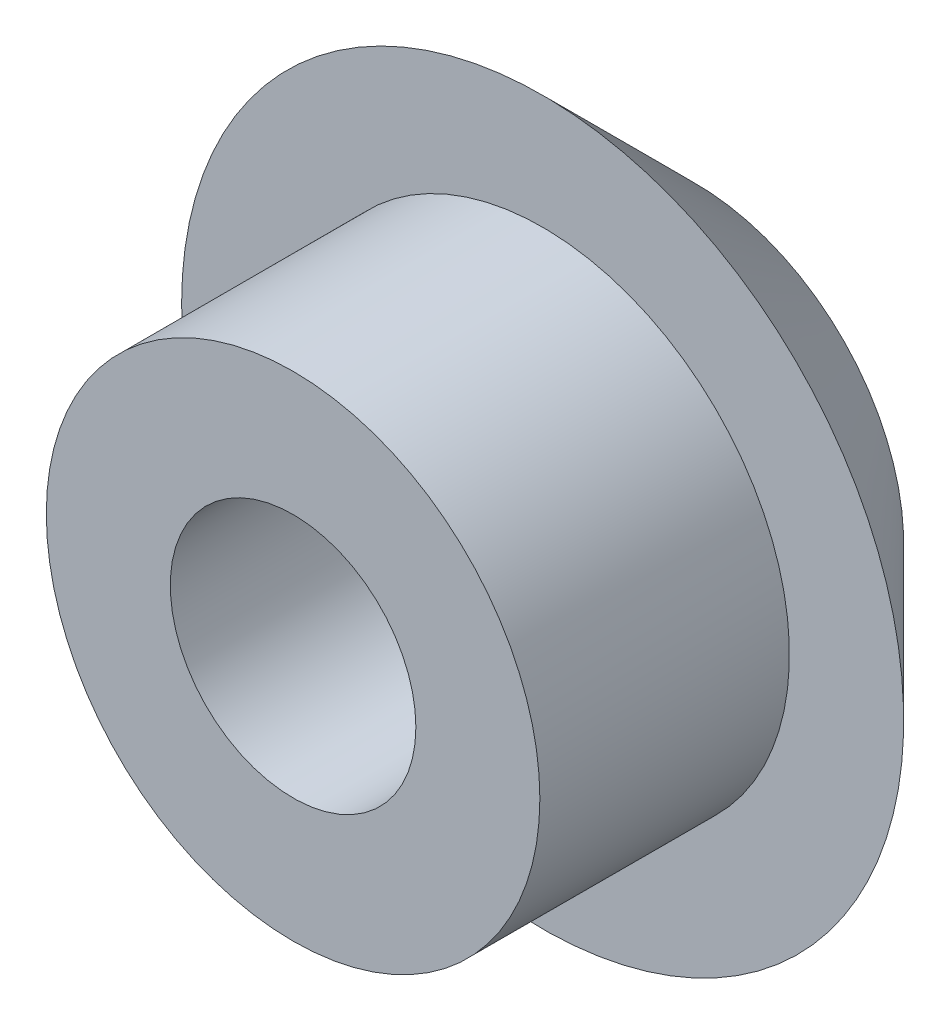
from build123d import *

# Parameters (mm, degrees)
ESQUISSE1_R        = 6.22
ESQUISSE1_R_2      = 3.095
BOSS_EXTRU_1_DEPTH = 10.14
ESQUISSE2_R        = 9.1
ESQUISSE2_R_2      = 6.22
BOSS_EXTRU_2_DEPTH = 3.85


with BuildPart() as part:
    # Esquisse1 → Boss.-Extru.1 (new body)
    with BuildSketch(Plane.XY):
        Circle(ESQUISSE1_R)
        Circle(ESQUISSE1_R_2, mode=Mode.SUBTRACT)
    extrude(amount=BOSS_EXTRU_1_DEPTH)

    # Esquisse2 → Boss.-Extru.2 (add)
    with BuildSketch(Plane(origin=(0, 0, 0), x_dir=(-1, 0, 0), z_dir=(0, 0, -1))):
        Circle(ESQUISSE2_R)
        Circle(ESQUISSE2_R_2, mode=Mode.SUBTRACT)
    extrude(amount=-BOSS_EXTRU_2_DEPTH)

    # Enlèvement de matière-Balayage1: sweep along a curve in space
    with BuildLine() as enl_vement_de_mati_re_balayage1_path:
        ThreePointArc((-9.1, 0, 0), (-6.434671709, 6.434671709, 0), (0, 9.1, 0))
        ThreePointArc((0, 9.1, 0), (6.434671709, 6.434671709, 0), (9.1, 0, 0))
        ThreePointArc((9.1, 0, 0), (6.434671709, -6.434671709, 0), (0, -9.1, 0))
        ThreePointArc((0, -9.1, 0), (-6.434671709, -6.434671709, 0), (-9.1, 0, 0))
    # Esquisse3 → Enlèvement de matière-Balayage1 (sweep, cut)
    with BuildSketch(Plane(origin=(0, 0, 0), x_dir=(1, 0, 0), z_dir=(0, 1, 0))):
        Polygon((-9.1, -3.85), (-5.25, 0), (-9.1, 0), align=None)
    sweep(path=enl_vement_de_mati_re_balayage1_path.line, mode=Mode.SUBTRACT)


solid = part.part
